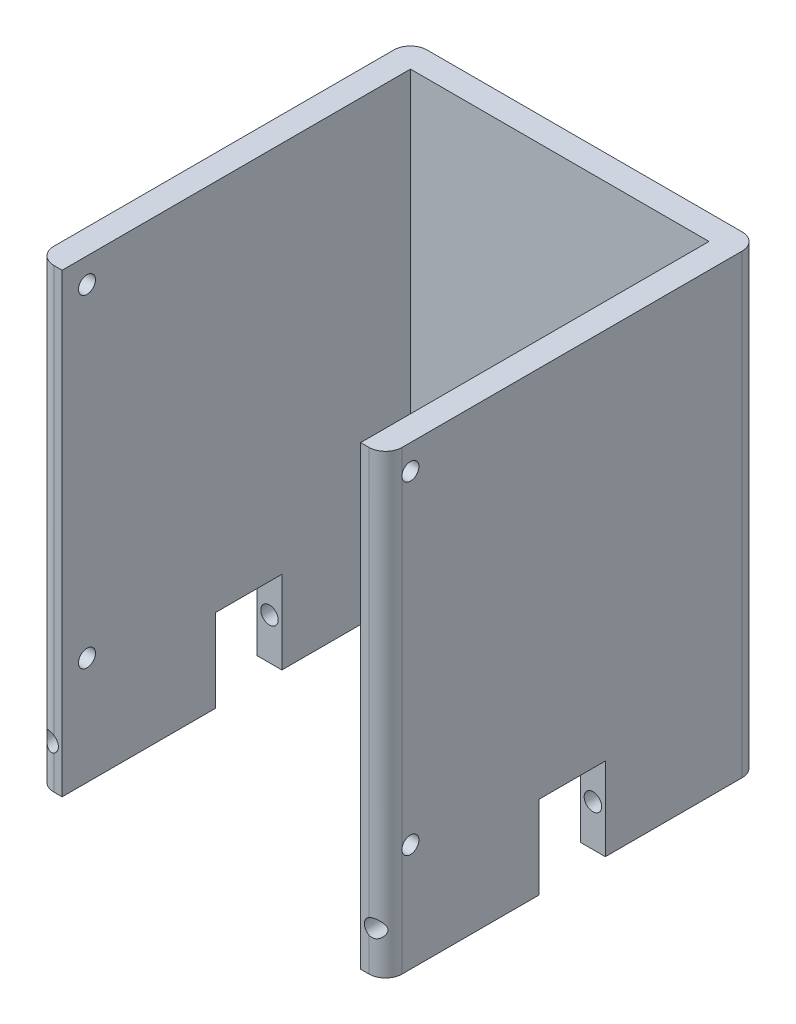
from build123d import *

# Parameters (mm, degrees)
EXTRUDE_1_DEPTH      = 40
EXTRUDE_1_DEPTH_BACK = 5
SKETCH_2_W           = 36
SKETCH_2_H           = 37
CUT_EXTRUDE_1_DEPTH  = 50
SKETCH_5_W           = 36
SKETCH_5_H           = 5
CUT_EXTRUDE_4_DEPTH  = 43
SKETCH_9_R           = 1.025
CUT_EXTRUDE_5_DEPTH  = 45.5
SKETCH_11_W          = 3
SKETCH_11_H          = 18.5
EXTRUDE_5_DEPTH      = 10
SKETCH_13_R          = 1.05
CUT_EXTRUDE_7_DEPTH  = 63.5
FILLET_4_R           = 2
FILLET_5_R           = 2
FILLET_6_R           = 2
FILLET_7_R           = 2


with BuildPart() as part:
    # 草圖1 → 填料-伸長1 (new, two sides: drawn at the far end of the back side and taken through both)
    with BuildSketch(Plane.XY.offset(-EXTRUDE_1_DEPTH_BACK)):
        Polygon((-14.545454545, -28.090909091), (-15.545454545, -28.090909091), (-15.545454545, 16.909090909), (-14.545454545, 16.909090909), (25.454545455, 16.909090909), (26.454545455, 16.909090909), (26.454545455, -28.090909091), (25.454545455, -28.090909091), align=None)
    extrude(amount=EXTRUDE_1_DEPTH + EXTRUDE_1_DEPTH_BACK)

    # 草圖2 → 除料-伸長1 (cut)
    with BuildSketch(Plane(origin=(0, 16.909090909, 0), x_dir=(1, 0, 0), z_dir=(0, 1, 0))):
        with Locations((5.454545455, -21.5)):
            Rectangle(SKETCH_2_W, SKETCH_2_H)
    extrude(amount=-CUT_EXTRUDE_1_DEPTH, mode=Mode.SUBTRACT)

    # 草圖5 → 除料-伸長4 (cut)
    with BuildSketch(Plane(origin=(0, 16.909090909, 0), x_dir=(1, 0, 0), z_dir=(0, 1, 0))):
        with Locations((5.454545455, -0.5)):
            Rectangle(SKETCH_5_W, SKETCH_5_H)
    extrude(amount=-CUT_EXTRUDE_4_DEPTH, mode=Mode.SUBTRACT)

    # 草圖9 → 除料-伸長5 (cut)
    with BuildSketch(Plane.ZY.offset(15.545454545)):
        with Locations(Location((37, -25.090909091, 0), (0, 0, 180))):
            Circle(SKETCH_9_R)
        with Locations(Location((37, 13.909090909, 0), (0, 0, 180))):
            Circle(SKETCH_9_R)
    extrude(amount=-CUT_EXTRUDE_5_DEPTH, mode=Mode.SUBTRACT)

    # 草圖11 → 填料-伸長5 (add)
    with BuildSketch(Plane(origin=(0, -28.090909091, 0), x_dir=(-1, 0, 0), z_dir=(0, -1, 0))):
        with Locations((-24.954545455, -30.75)):
            Rectangle(SKETCH_11_W, SKETCH_11_H)
        with Locations((-24.954545455, -4.25)):
            Rectangle(SKETCH_11_W, SKETCH_11_H)
        with Locations((14.045454545, -30.75)):
            Rectangle(SKETCH_11_W, SKETCH_11_H)
        with Locations((14.045454545, -4.25)):
            Rectangle(SKETCH_11_W, SKETCH_11_H)
    extrude(amount=EXTRUDE_5_DEPTH)

    # 草圖13 → 除料-伸長7 (cut)
    with BuildSketch(Plane(origin=(0, 0, -5), x_dir=(-1, 0, 0), z_dir=(0, 0, -1))):
        with Locations((-24.954545455, -33.090909091)):
            Circle(SKETCH_13_R)
        with Locations((14.045454545, -33.090909091)):
            Circle(SKETCH_13_R)
    extrude(amount=-CUT_EXTRUDE_7_DEPTH, mode=Mode.SUBTRACT)

    # 圓角4
    # the kernel refuses this fillet: 2 mm, written as the material it takes off along each edge
    with BuildSketch(Plane(origin=(26.454545455, 21.909090909, -5), x_dir=(-1, 0, 0), z_dir=(0, -1, 0))) as fillet_4_piece_1:
        with BuildLine():
            CenterArc((FILLET_4_R, -FILLET_4_R), FILLET_4_R, 90, 90)
            Line((0, -FILLET_4_R), (0, 0))
            Line((0, 0), (FILLET_4_R, 0))
        make_face()
    extrude(amount=65, mode=Mode.SUBTRACT)

    # 圓角5
    # the kernel refuses this fillet: 2 mm, written as the material it takes off along each edge
    with BuildSketch(Plane(origin=(-15.545454545, 21.909090909, -5), x_dir=(0, 0, 1), z_dir=(0, -1, 0))) as fillet_5_piece_1:
        with BuildLine():
            CenterArc((FILLET_5_R, -FILLET_5_R), FILLET_5_R, 90, 90)
            Line((0, -FILLET_5_R), (0, 0))
            Line((0, 0), (FILLET_5_R, 0))
        make_face()
    extrude(amount=65, mode=Mode.SUBTRACT)

    # 圓角6
    # the kernel refuses this fillet: 2 mm, written as the material it takes off along each edge
    with BuildSketch(Plane(origin=(26.454545455, -43.090909091, 40), x_dir=(0, 0, -1), z_dir=(0, 1, 0))) as fillet_6_piece_1:
        with BuildLine():
            CenterArc((FILLET_6_R, FILLET_6_R), FILLET_6_R, 180, 90)
            Line((0, FILLET_6_R), (0, 0))
            Line((0, 0), (FILLET_6_R, 0))
        make_face()
    extrude(amount=65, mode=Mode.SUBTRACT)

    # 圓角7
    # the kernel refuses this fillet: 2 mm, written as the material it takes off along each edge
    with BuildSketch(Plane(origin=(-15.545454545, -43.090909091, 40), x_dir=(0, 0, -1), z_dir=(0, 1, 0))) as fillet_7_piece_1:
        with BuildLine():
            CenterArc((FILLET_7_R, -FILLET_7_R), FILLET_7_R, 90, 90)
            Line((0, -FILLET_7_R), (0, 0))
            Line((0, 0), (FILLET_7_R, 0))
        make_face()
    extrude(amount=65, mode=Mode.SUBTRACT)


solid = part.part
